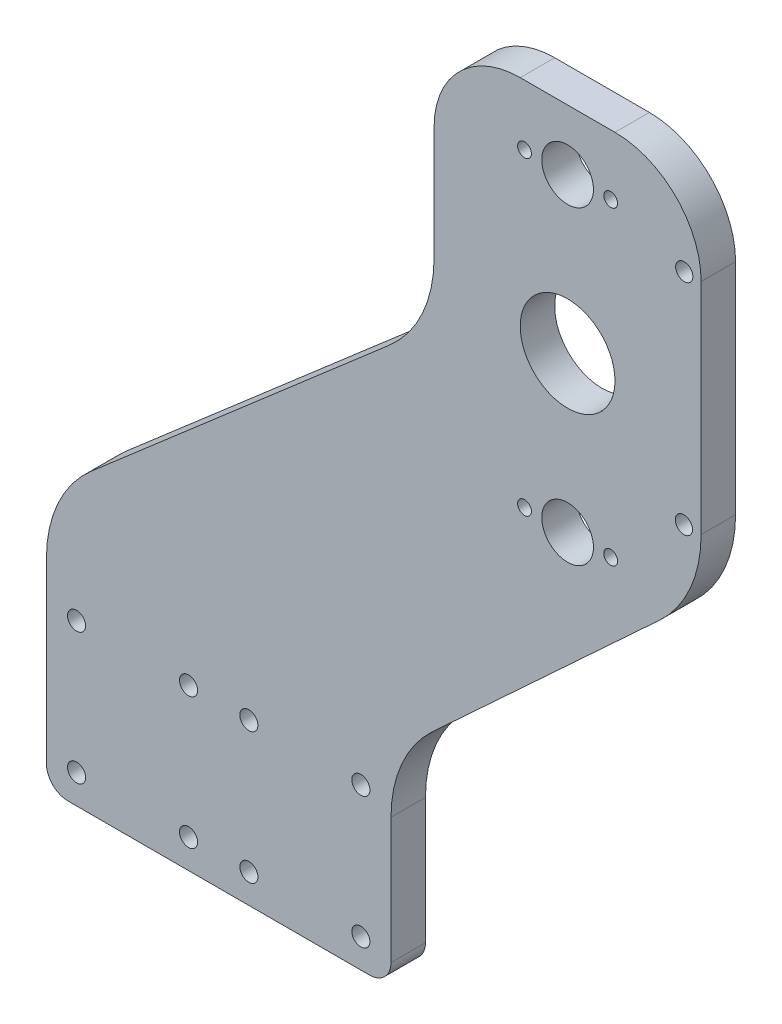
from build123d import *

# Parameters (mm, degrees)
SKETCH1_R           = 2.1
SKETCH1_R_2         = 6
SKETCH1_R_3         = 11
SKETCH1_R_4         = 2
SKETCH1_R_5         = 1.6
BOSS_EXTRUDE1_DEPTH = 8


with BuildPart() as part:
    # Sketch1 → Boss-Extrude1 (new body)
    with BuildSketch(Plane.XY):
        with BuildLine():
            Line((-58.706905953, -89.435290589), (11.293094047, -89.435290589))
            ThreePointArc((11.293094047, -89.435290589), (14.828627953, -87.970824495), (16.293094047, -84.435290589))
            Line((16.293094047, -84.435290589), (16.293094047, -55.206132823))
            ThreePointArc((16.293094047, -55.206132823), (18.805483161, -43.188177597), (25.921843901, -33.18314103))
            Line((25.921843901, -33.18314103), (78.664344192, 15.603630397))
            ThreePointArc((78.664344192, 15.603630397), (85.780704932, 25.608666964), (88.293094047, 37.62662219))
            Line((88.293094047, 37.62662219), (88.293094047, 88.509385275))
            ThreePointArc((88.293094047, 88.509385275), (82.43522967, 102.651520898), (68.293094047, 108.509385275))
            Line((68.293094047, 108.509385275), (46.293094047, 108.509385275))
            ThreePointArc((46.293094047, 108.509385275), (32.150958423, 102.651520898), (26.293094047, 88.509385275))
            Line((26.293094047, 88.509385275), (26.293094047, 62.214617761))
            ThreePointArc((26.293094047, 62.214617761), (23.580441162, 49.748636556), (15.93304822, 39.537047343))
            Line((15.93304822, 39.537047343), (-53.346860127, -20.462952657))
            ThreePointArc((-53.346860127, -20.462952657), (-60.994253069, -30.674541871), (-63.706905953, -43.140523075))
            Line((-63.706905953, -43.140523075), (-63.706905953, -84.435290589))
            ThreePointArc((-63.706905953, -84.435290589), (-62.242439859, -87.970824495), (-58.706905953, -89.435290589))
        make_face()
        with Locations((-56.706905953, -52.185290589)):
            Circle(SKETCH1_R, mode=Mode.SUBTRACT)
        with Locations((-30.706905953, -52.185290589)):
            Circle(SKETCH1_R, mode=Mode.SUBTRACT)
        with Locations((-30.706905953, -82.685290589)):
            Circle(SKETCH1_R, mode=Mode.SUBTRACT)
        with Locations((-56.706905953, -82.685290589)):
            Circle(SKETCH1_R, mode=Mode.SUBTRACT)
        with Locations((9.293094047, -82.685290589)):
            Circle(SKETCH1_R, mode=Mode.SUBTRACT)
        with Locations((-16.706905953, -82.685290589)):
            Circle(SKETCH1_R, mode=Mode.SUBTRACT)
        with Locations((-16.706905953, -52.185290589)):
            Circle(SKETCH1_R, mode=Mode.SUBTRACT)
        with Locations((9.293094047, -52.185290589)):
            Circle(SKETCH1_R, mode=Mode.SUBTRACT)
        with Locations((57.293094047, 94.509385275)):
            Circle(SKETCH1_R_2, mode=Mode.SUBTRACT)
        with Locations((57.293094047, 22.569385275)):
            Circle(SKETCH1_R_2, mode=Mode.SUBTRACT)
        with Locations((57.293094047, 58.539385275)):
            Circle(SKETCH1_R_3, mode=Mode.SUBTRACT)
        with Locations((84.293094047, 37.62662219)):
            Circle(SKETCH1_R_4, mode=Mode.SUBTRACT)
        with Locations((84.375885899, 88.528341433)):
            Circle(SKETCH1_R_4, mode=Mode.SUBTRACT)
        with Locations((47.293094047, 94.509385275)):
            Circle(SKETCH1_R_5, mode=Mode.SUBTRACT)
        with Locations((47.293094047, 22.569385275)):
            Circle(SKETCH1_R_5, mode=Mode.SUBTRACT)
        with Locations((67.293094047, 94.509385275)):
            Circle(SKETCH1_R_5, mode=Mode.SUBTRACT)
        with Locations((67.293094047, 22.569385275)):
            Circle(SKETCH1_R_5, mode=Mode.SUBTRACT)
    extrude(amount=BOSS_EXTRUDE1_DEPTH)


solid = part.part
